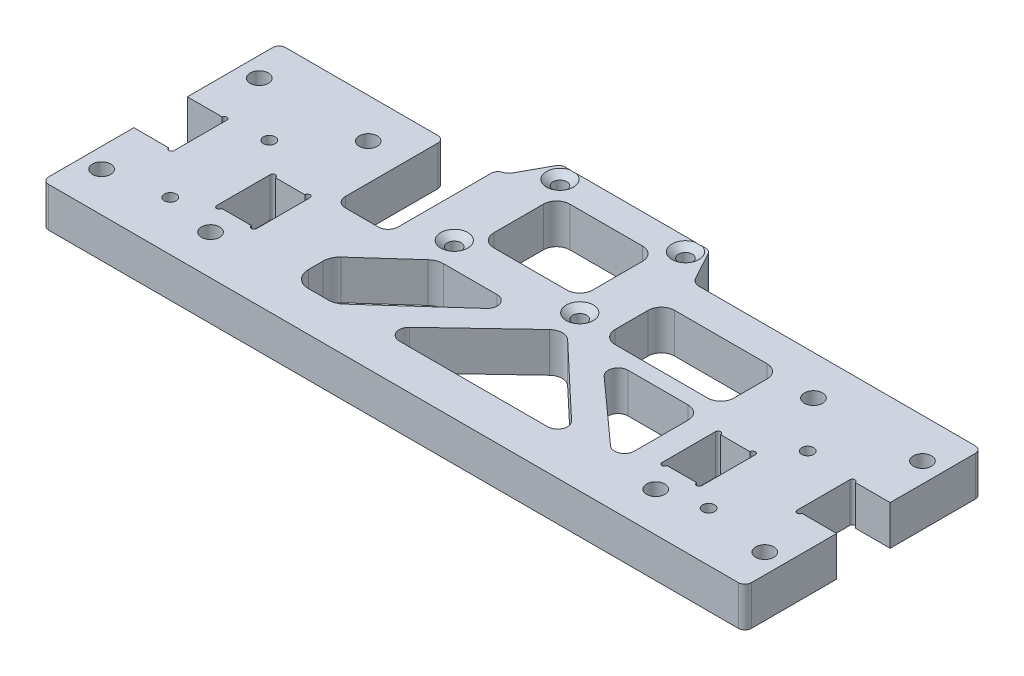
from build123d import *

# Parameters (mm, degrees)
SKETCH1_R           = 2.75
BOSS_EXTRUDE1_DEPTH = 12
SKETCH2_W           = 16
SKETCH2_H           = 46.496113018
CUT_EXTRUDE1_DEPTH  = 229.638147517
SKETCH3_R           = 2.1
CUT_EXTRUDE2_DEPTH  = 229.638147517
CUT_EXTRUDE3_DEPTH  = 229.638147517
FILLET1_R           = 3
FILLET2_R           = 2
SKETCH6_R           = 1.8
CUT_EXTRUDE4_DEPTH  = 229.638147652
CHAMFER1_SIZE       = 1.678199262
CHAMFER1_SIZE_2     = 2


with BuildPart() as part:
    # Sketch1 → Boss-Extrude1 (new body)
    with BuildSketch(Plane(origin=(0, 0, 0), x_dir=(1, 0, 0), z_dir=(0, 1, 0))):
        with BuildLine():
            Line((0, 71.75), (68.4, 71.75))
            Line((68.4, 71.75), (74.4, 82.75))
            Line((74.4, 82.75), (119.4, 82.75))
            Line((119.4, 82.75), (125.4, 71.75))
            Line((125.4, 71.75), (212.8, 71.75))
            Line((212.8, 71.75), (212.8, 43.975))
            Line((212.8, 43.975), (202.281088693, 43.975))
            ThreePointArc((202.281088693, 43.975), (201.490544346, 44.652363805), (200.7, 43.975))
            Line((200.7, 43.975), (200.7, 27.775))
            ThreePointArc((200.7, 27.775), (201.490544346, 27.097636195), (202.281088693, 27.775))
            Line((202.281088693, 27.775), (212.8, 27.775))
            Line((212.8, 27.775), (212.8, 0))
            Line((212.8, 0), (106.4, 0))
            Line((106.4, 0), (0, 0))
            Line((0, 0), (0, 27.775))
            Line((0, 27.775), (10.518911307, 27.775))
            ThreePointArc((10.518911307, 27.775), (11.309455654, 27.097636195), (12.1, 27.775))
            Line((12.1, 27.775), (12.1, 43.975))
            ThreePointArc((12.1, 43.975), (11.309455654, 44.652363805), (10.518911307, 43.975))
            Line((10.518911307, 43.975), (0, 43.975))
            Line((0, 43.975), (0, 71.75))
        make_face()
        with Locations(Location((39, 59.75, 0), (0, 0, 270))):
            Circle(SKETCH1_R, mode=Mode.SUBTRACT)
        with Locations(Location((39, 12, 0), (0, 0, 270))):
            Circle(SKETCH1_R, mode=Mode.SUBTRACT)
        with Locations(Location((173.8, 59.75, 0), (0, 0, 90))):
            Circle(SKETCH1_R, mode=Mode.SUBTRACT)
        with Locations(Location((173.8, 12, 0), (0, 0, 90))):
            Circle(SKETCH1_R, mode=Mode.SUBTRACT)
        with Locations(Location((6, 12, 0), (0, 0, 270))):
            Circle(SKETCH1_R, mode=Mode.SUBTRACT)
        with Locations(Location((6, 59.75, 0), (0, 0, 270))):
            Circle(SKETCH1_R, mode=Mode.SUBTRACT)
        with Locations(Location((206.8, 59.75, 0), (0, 0, 90))):
            Circle(SKETCH1_R, mode=Mode.SUBTRACT)
        with Locations(Location((206.8, 12, 0), (0, 0, 90))):
            Circle(SKETCH1_R, mode=Mode.SUBTRACT)
        with BuildLine():
            Line((32.95, 36.1), (32.95, 19.9))
            ThreePointArc((32.95, 19.9), (33.75, 19.1), (34.55, 19.9))
            Line((34.55, 19.9), (43.45, 19.9))
            ThreePointArc((43.45, 19.9), (44.25, 19.1), (45.05, 19.9))
            Line((45.05, 19.9), (45.05, 36.1))
            ThreePointArc((45.05, 36.1), (44.25, 36.9), (43.45, 36.1))
            Line((43.45, 36.1), (34.55, 36.1))
            ThreePointArc((34.55, 36.1), (33.75, 36.9), (32.95, 36.1))
        make_face(mode=Mode.SUBTRACT)
        with BuildLine():
            Line((179.85, 36.1), (179.85, 19.9))
            ThreePointArc((179.85, 19.9), (179.05, 19.1), (178.25, 19.9))
            Line((178.25, 19.9), (169.35, 19.9))
            ThreePointArc((169.35, 19.9), (168.55, 19.1), (167.75, 19.9))
            Line((167.75, 19.9), (167.75, 36.1))
            ThreePointArc((167.75, 36.1), (168.55, 36.9), (169.35, 36.1))
            Line((169.35, 36.1), (178.25, 36.1))
            ThreePointArc((178.25, 36.1), (179.05, 36.9), (179.85, 36.1))
        make_face(mode=Mode.SUBTRACT)
    extrude(amount=BOSS_EXTRUDE1_DEPTH)

    # Sketch2 → Cut-Extrude1 (cut, through all)
    with BuildSketch(Plane(origin=(0, 12, 0), x_dir=(1, 0, 0), z_dir=(0, 1, 0))):
        with Locations((58.05, 61.998056509)):
            Rectangle(SKETCH2_W, SKETCH2_H)
    extrude(amount=-CUT_EXTRUDE1_DEPTH, mode=Mode.SUBTRACT)

    # Sketch3 → Cut-Extrude2 (cut, through all)
    with BuildSketch(Plane(origin=(0, 12, 0), x_dir=(1, 0, 0), z_dir=(0, 1, 0))):
        with Locations(Location((78.05, 78.75, 0), (0, 0, 270))):
            Circle(SKETCH3_R)
        with Locations(Location((78.05, 46.75, 0), (0, 0, 270))):
            Circle(SKETCH3_R)
        with Locations(Location((116.05, 78.75, 0), (0, 0, 270))):
            Circle(SKETCH3_R)
        with Locations(Location((116.05, 46.75, 0), (0, 0, 270))):
            Circle(SKETCH3_R)
    extrude(amount=-CUT_EXTRUDE2_DEPTH, mode=Mode.SUBTRACT)

    # Sketch5 → Cut-Extrude3 (cut, through all)
    with BuildSketch(Plane(origin=(0, 12, 0), x_dir=(1, 0, 0), z_dir=(0, 1, 0))):
        with BuildLine():
            Line((98.782125318, 39), (82.518680026, 39))
            ThreePointArc((82.518680026, 39), (80.72736119, 38.668102058), (79.173856368, 37.716470731))
            Line((79.173856368, 37.716470731), (65.279045214, 25.211140692))
            ThreePointArc((65.279045214, 25.211140692), (64.056368555, 23.528862886), (63.623868872, 21.494669961))
            Line((63.623868872, 21.494669961), (63.623868872, 17))
            ThreePointArc((63.623868872, 17), (65.088334966, 13.464466094), (68.623868872, 12))
            Line((68.623868872, 12), (74.681319974, 12))
            ThreePointArc((74.681319974, 12), (76.47263881, 12.331897942), (78.026143632, 13.283529269))
            Line((78.026143632, 13.283529269), (100.789019513, 33.770117561))
            ThreePointArc((100.789019513, 33.770117561), (101.582986553, 37.074791302), (98.782125318, 39))
        make_face()
        with BuildLine():
            Line((115.851322474, 37.77611222), (94.075922745, 17.179491723))
            ThreePointArc((94.075922745, 17.179491723), (93.350095678, 13.890602679), (96.13743089, 12))
            Line((96.13743089, 12), (141.06256911, 12))
            ThreePointArc((141.06256911, 12), (143.849904322, 13.890602679), (143.124077255, 17.179491723))
            Line((143.124077255, 17.179491723), (121.348677526, 37.77611222))
            ThreePointArc((121.348677526, 37.77611222), (118.6, 38.870123257), (115.851322474, 37.77611222))
        make_face()
        with BuildLine():
            Line((138.417874682, 39), (156.6, 39))
            ThreePointArc((156.6, 39), (159.428427125, 37.828427125), (160.6, 35))
            Line((160.6, 35), (160.6, 18.736087214))
            ThreePointArc((160.6, 18.736087214), (158.820515755, 15.995587024), (155.593105805, 16.506204775))
            Line((155.593105805, 16.506204775), (136.410980487, 33.770117561))
            ThreePointArc((136.410980487, 33.770117561), (135.617013447, 37.074791302), (138.417874682, 39))
        make_face()
        with BuildLine():
            Line((86.05, 73.75), (108.05, 73.75))
            ThreePointArc((108.05, 73.75), (110.878427125, 72.578427125), (112.05, 69.75))
            Line((112.05, 69.75), (112.05, 54.75))
            ThreePointArc((112.05, 54.75), (110.878427125, 51.921572875), (108.05, 50.75))
            Line((108.05, 50.75), (86.05, 50.75))
            ThreePointArc((86.05, 50.75), (83.221572875, 51.921572875), (82.05, 54.75))
            Line((82.05, 54.75), (82.05, 69.75))
            ThreePointArc((82.05, 69.75), (83.221572875, 72.578427125), (86.05, 73.75))
        make_face()
        with BuildLine():
            Line((129.75, 61.75), (157.75, 61.75))
            ThreePointArc((157.75, 61.75), (160.578427125, 60.578427125), (161.75, 57.75))
            Line((161.75, 57.75), (161.75, 47.75))
            ThreePointArc((161.75, 47.75), (160.578427125, 44.921572875), (157.75, 43.75))
            Line((157.75, 43.75), (129.75, 43.75))
            ThreePointArc((129.75, 43.75), (126.921572875, 44.921572875), (125.75, 47.75))
            Line((125.75, 47.75), (125.75, 57.75))
            ThreePointArc((125.75, 57.75), (126.921572875, 60.578427125), (129.75, 61.75))
        make_face()
    extrude(amount=-CUT_EXTRUDE3_DEPTH, mode=Mode.SUBTRACT)

    # Fillet1
    fillet1_edges = [part.edges().sort_by_distance(p)[0] for p in [
        (50.05, 6, -38.75),
        (66.05, 6, -38.75),
        (68.4, 6, -71.75),
        (125.4, 6, -71.75),
    ]]
    fillet(fillet1_edges, radius=FILLET1_R)

    # Fillet2
    fillet2_edges = [part.edges().sort_by_distance(p)[0] for p in [
        (212.8, 6, -71.75),
        (119.4, 6, -82.75),
        (74.4, 6, -82.75),
        (50.05, 6, -71.75),
        (66.05, 6, -71.75),
        (0, 6, -71.75),
        (212.8, 6, 0),
        (0, 6, 0),
    ]]
    fillet(fillet2_edges, radius=FILLET2_R)

    # Sketch6 → Cut-Extrude4 (cut, through all)
    with BuildSketch(Plane(origin=(0, 12, 0), x_dir=(1, 0, 0), z_dir=(0, 1, 0))):
        with Locations(Location((186.8, 45, 0), (0, 0, 270))):
            Circle(SKETCH6_R)
        with Locations(Location((186.8, 15, 0), (0, 0, 270))):
            Circle(SKETCH6_R)
        with Locations(Location((23.8, 45, 0), (0, 0, 90))):
            Circle(SKETCH6_R)
        with Locations(Location((23.8, 15, 0), (0, 0, 90))):
            Circle(SKETCH6_R)
    extrude(amount=-CUT_EXTRUDE4_DEPTH, mode=Mode.SUBTRACT)

    # Chamfer1
    # the kernel refuses this chamfer: 2, 1.678199262 mm, written as the material it takes off along each edge
    with BuildSketch(Plane(origin=(78.05, 12, -46.75), x_dir=(0, 0, 1), z_dir=(-1, 0, 0))) as chamfer1_piece_1:
        Polygon((2.1, -CHAMFER1_SIZE), (2.1 + CHAMFER1_SIZE_2, 0), (2.1, 0), align=None)
    revolve(axis=Axis((78.05, 12, -46.75), (0, 1, 0)), mode=Mode.SUBTRACT)
    with BuildSketch(Plane(origin=(116.05, 12, -78.75), x_dir=(0, 0, 1), z_dir=(-1, 0, 0))) as chamfer1_piece_2:
        Polygon((2.1, -CHAMFER1_SIZE), (2.1 + CHAMFER1_SIZE_2, 0), (2.1, 0), align=None)
    revolve(axis=Axis((116.05, 12, -78.75), (0, 1, 0)), mode=Mode.SUBTRACT)
    with BuildSketch(Plane(origin=(116.05, 12, -46.75), x_dir=(0, 0, 1), z_dir=(-1, 0, 0))) as chamfer1_piece_3:
        Polygon((2.1, -CHAMFER1_SIZE), (2.1 + CHAMFER1_SIZE_2, 0), (2.1, 0), align=None)
    revolve(axis=Axis((116.05, 12, -46.75), (0, 1, 0)), mode=Mode.SUBTRACT)
    with BuildSketch(Plane(origin=(78.05, 12, -78.75), x_dir=(0, 0, 1), z_dir=(-1, 0, 0))) as chamfer1_piece_4:
        Polygon((2.1, -CHAMFER1_SIZE), (2.1 + CHAMFER1_SIZE_2, 0), (2.1, 0), align=None)
    revolve(axis=Axis((78.05, 12, -78.75), (0, 1, 0)), mode=Mode.SUBTRACT)


solid = part.part
